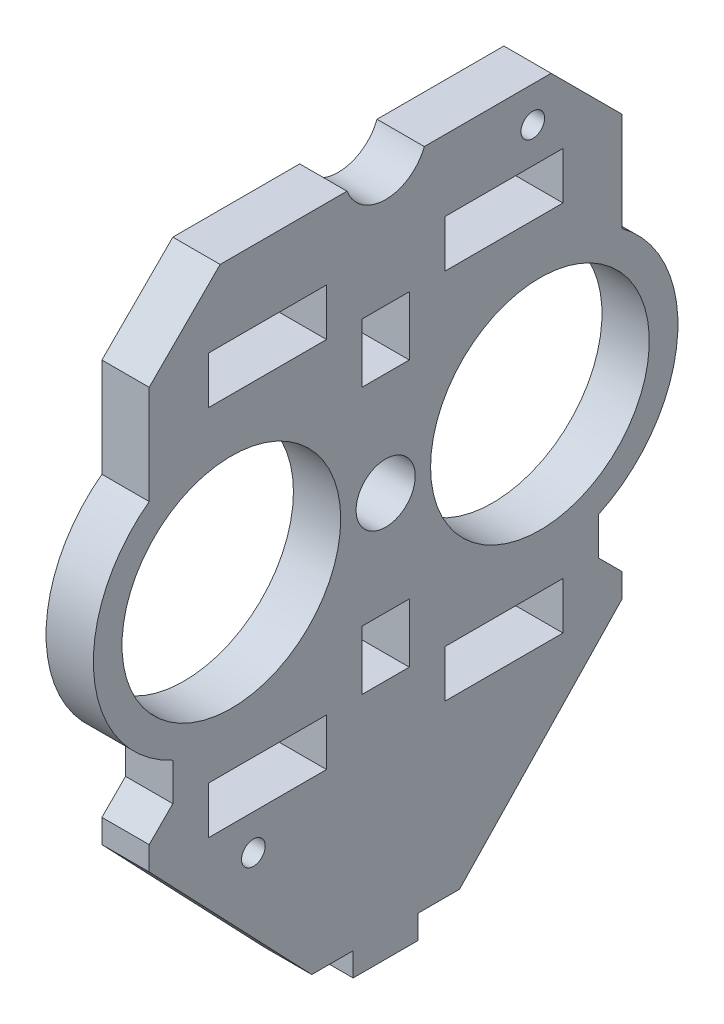
from build123d import *

# Parameters (mm, degrees)
SKETCH1_R           = 2
SKETCH1_R_2         = 18.5
SKETCH1_R_3         = 5
BOSS_EXTRUDE1_DEPTH = 8
CUT_EXTRUDE1_REACH  = 86.69
SKETCH2_W           = 20
SKETCH2_H           = 8
SKETCH2_W_2         = 8
SKETCH2_H_2         = 10
SKETCH2_W_3         = 7
SKETCH2_H_3         = 4


with BuildPart() as part:
    # Sketch1 → Boss-Extrude1 (new body)
    with BuildSketch(Plane(origin=(0, 0, 0), x_dir=(0, 0, -1), z_dir=(1, 0, 0))):
        with BuildLine():
            Line((-12.5, -64.29), (-40, -35.5))
            Line((-40, -35.5), (-40, -31.5))
            Line((-40, -31.5), (-36, -27.5))
            Line((-36, -27.5), (-36, -21.143055078))
            ThreePointArc((-36, -21.143055078), (-49.329627244, -2.32877567), (-40, 18.757099403))
            Line((-40, 18.757099403), (-40, 35.5))
            Line((-40, 35.5), (-28, 47.5))
            Line((-28, 47.5), (-6.538348415, 47.5))
            ThreePointArc((-6.538348415, 47.5), (0, 43), (6.538348415, 47.5))
            Line((6.538348415, 47.5), (28, 47.5))
            Line((28, 47.5), (40, 35.5))
            Line((40, 35.5), (40, 18.757099403))
            ThreePointArc((40, 18.757099403), (49.329627244, -2.32877567), (36, -21.143055078))
            Line((36, -21.143055078), (36, -27.5))
            Line((36, -27.5), (40, -31.5))
            Line((40, -31.5), (40, -35.5))
            Line((40, -35.5), (12.5, -64.29))
            Line((12.5, -64.29), (12.5, -68.29))
            Line((12.5, -68.29), (-12.5, -68.29))
            Line((-12.5, -68.29), (-12.5, -64.29))
        make_face()
        with Locations((-22.373880505, -41.5)):
            Circle(SKETCH1_R, mode=Mode.SUBTRACT)
        with Locations((24.891578032, 41.5)):
            Circle(SKETCH1_R, mode=Mode.SUBTRACT)
        with Locations((-26.1, 0)):
            Circle(SKETCH1_R_2, mode=Mode.SUBTRACT)
        with Locations((26.1, 0)):
            Circle(SKETCH1_R_2, mode=Mode.SUBTRACT)
        Circle(SKETCH1_R_3, mode=Mode.SUBTRACT)
    extrude(amount=BOSS_EXTRUDE1_DEPTH)

    # Sketch2 → Cut-Extrude1 (cut, up to next)
    with BuildSketch(Plane.ZY, mode=Mode.PRIVATE) as cut_extrude1_sk1:
        with Locations((20, -31.5)):
            Rectangle(SKETCH2_W, SKETCH2_H)
    cut_extrude1_tool1 = extrude(cut_extrude1_sk1.sketch, amount=-CUT_EXTRUDE1_REACH, mode=Mode.PRIVATE) & part.part
    # Sketch2 → Cut-Extrude1 (cut, up to next)
    with BuildSketch(Plane.ZY, mode=Mode.PRIVATE) as cut_extrude1_sk2:
        with Locations((-20, -31.5)):
            Rectangle(SKETCH2_W, SKETCH2_H)
    cut_extrude1_tool2 = extrude(cut_extrude1_sk2.sketch, amount=-CUT_EXTRUDE1_REACH, mode=Mode.PRIVATE) & part.part
    # Sketch2 → Cut-Extrude1 (cut, up to next)
    with BuildSketch(Plane.ZY, mode=Mode.PRIVATE) as cut_extrude1_sk3:
        with Locations((20, 31.5)):
            Rectangle(SKETCH2_W, SKETCH2_H)
    cut_extrude1_tool3 = extrude(cut_extrude1_sk3.sketch, amount=-CUT_EXTRUDE1_REACH, mode=Mode.PRIVATE) & part.part
    # Sketch2 → Cut-Extrude1 (cut, up to next)
    with BuildSketch(Plane.ZY, mode=Mode.PRIVATE) as cut_extrude1_sk4:
        with Locations((-20, 31.5)):
            Rectangle(SKETCH2_W, SKETCH2_H)
    cut_extrude1_tool4 = extrude(cut_extrude1_sk4.sketch, amount=-CUT_EXTRUDE1_REACH, mode=Mode.PRIVATE) & part.part
    # Sketch2 → Cut-Extrude1 (cut, up to next)
    with BuildSketch(Plane.ZY, mode=Mode.PRIVATE) as cut_extrude1_sk5:
        with Locations((0, 22.5)):
            Rectangle(SKETCH2_W_2, SKETCH2_H_2)
    cut_extrude1_tool5 = extrude(cut_extrude1_sk5.sketch, amount=-CUT_EXTRUDE1_REACH, mode=Mode.PRIVATE) & part.part
    # Sketch2 → Cut-Extrude1 (cut, up to next)
    with BuildSketch(Plane.ZY, mode=Mode.PRIVATE) as cut_extrude1_sk6:
        with Locations((0, -22.5)):
            Rectangle(SKETCH2_W_2, SKETCH2_H_2)
    cut_extrude1_tool6 = extrude(cut_extrude1_sk6.sketch, amount=-CUT_EXTRUDE1_REACH, mode=Mode.PRIVATE) & part.part
    # Sketch2 → Cut-Extrude1 (cut, up to next)
    with BuildSketch(Plane.ZY, mode=Mode.PRIVATE) as cut_extrude1_sk7:
        with Locations((9, -66.29)):
            Rectangle(SKETCH2_W_3, SKETCH2_H_3)
    cut_extrude1_tool7 = extrude(cut_extrude1_sk7.sketch, amount=-CUT_EXTRUDE1_REACH, mode=Mode.PRIVATE) & part.part
    # Sketch2 → Cut-Extrude1 (cut, up to next)
    with BuildSketch(Plane.ZY, mode=Mode.PRIVATE) as cut_extrude1_sk8:
        with Locations((-9, -66.29)):
            Rectangle(SKETCH2_W_3, SKETCH2_H_3)
    cut_extrude1_tool8 = extrude(cut_extrude1_sk8.sketch, amount=-CUT_EXTRUDE1_REACH, mode=Mode.PRIVATE) & part.part
    add(cut_extrude1_tool1.solids().sort_by_distance((0, -31.5, 20))[0], mode=Mode.SUBTRACT)
    add(cut_extrude1_tool2.solids().sort_by_distance((0, -31.5, -20))[0], mode=Mode.SUBTRACT)
    add(cut_extrude1_tool3.solids().sort_by_distance((0, 31.5, 20))[0], mode=Mode.SUBTRACT)
    add(cut_extrude1_tool4.solids().sort_by_distance((0, 31.5, -20))[0], mode=Mode.SUBTRACT)
    add(cut_extrude1_tool5.solids().sort_by_distance((0, 22.5, 0))[0], mode=Mode.SUBTRACT)
    add(cut_extrude1_tool6.solids().sort_by_distance((0, -22.5, 0))[0], mode=Mode.SUBTRACT)
    add(cut_extrude1_tool7.solids().sort_by_distance((0, -66.29, 9))[0], mode=Mode.SUBTRACT)
    add(cut_extrude1_tool8.solids().sort_by_distance((0, -66.29, -9))[0], mode=Mode.SUBTRACT)


solid = part.part
